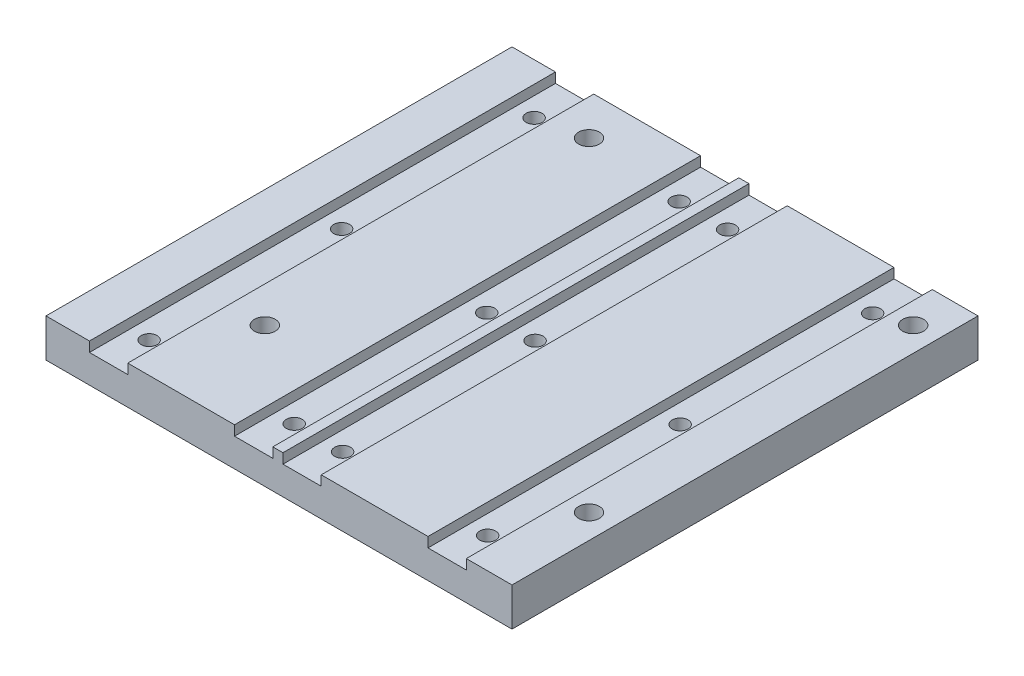
from build123d import *

# Parameters (mm, degrees)
SKETCH1_W                                       = 146.05
SKETCH1_H                                       = 146.05
BOSS_EXTRUDE1_DEPTH                             = 12
F_1_4_CLEARANCE_HOLE1_D                         = 6.5278
SKETCH4_W                                       = 12
SKETCH4_H                                       = 3.11
CUT_EXTRUDE1_DEPTH                              = 164.729206695
CBORE_FOR_10_SOCKET_HEAD_CAP_SCREW1_D           = 4.9784
CBORE_FOR_10_SOCKET_HEAD_CAP_SCREW1_CBORE_D     = 9.525
CBORE_FOR_10_SOCKET_HEAD_CAP_SCREW1_CBORE_DEPTH = 5.08
LPATTERN1_COUNT                                 = 2
LPATTERN1_PITCH                                 = 45.466
LPATTERN1_COUNT_DIR2                            = 2
LPATTERN1_PITCH_DIR2                            = 60.640999876


with BuildPart() as part:
    # Sketch1 → Boss-Extrude1 (new body)
    with BuildSketch(Plane(origin=(0, 0, 0), x_dir=(1, 0, 0), z_dir=(0, 1, 0))):
        Rectangle(SKETCH1_W, SKETCH1_H)
    extrude(amount=-BOSS_EXTRUDE1_DEPTH)

    # 1/4 Clearance Hole1 (through all)
    with Locations(Plane(origin=(0, 0, 0), x_dir=(1, 0, 0), z_dir=(0, 1, 0))):
        with Locations((-36.195, 60.325), (-36.195, -41.275), (65.405, -41.275), (65.405, 60.325)):
            Hole(F_1_4_CLEARANCE_HOLE1_D / 2)

    # Sketch4 → Cut-Extrude1 (cut, through all)
    with BuildSketch(Plane.XY.offset(73.025)):
        with Locations((52.705, -1.555)):
            Rectangle(SKETCH4_W, SKETCH4_H)
    cut_extrude1 = extrude(amount=-CUT_EXTRUDE1_DEPTH, mode=Mode.SUBTRACT)

    # CBORE for #10 Socket Head Cap Screw1 (through all)
    with Locations(Plane(origin=(0, -12, 0), x_dir=(-1, 0, 0), z_dir=(0, -1, 0))):
        with Locations((-52.705, -60.325), (-52.705, 60.325), (-52.705, 0)):
            cbore_for_10_socket_head_cap_screw1 = CounterBoreHole(CBORE_FOR_10_SOCKET_HEAD_CAP_SCREW1_D / 2, CBORE_FOR_10_SOCKET_HEAD_CAP_SCREW1_CBORE_D / 2, CBORE_FOR_10_SOCKET_HEAD_CAP_SCREW1_CBORE_DEPTH)

    # LPattern1: Cut-Extrude1, CBORE for _10 Socket Head Cap Screw1 2 × 2
    with Locations(*[Vector(-1, 0, 0) * (i * LPATTERN1_PITCH) + Vector(-1, 0, 0) * (j * LPATTERN1_PITCH_DIR2) for i in range(LPATTERN1_COUNT) for j in range(LPATTERN1_COUNT_DIR2) if (i, j) != (0, 0)]):
        add(cut_extrude1, mode=Mode.SUBTRACT)
        add(cbore_for_10_socket_head_cap_screw1, mode=Mode.SUBTRACT)


solid = part.part
